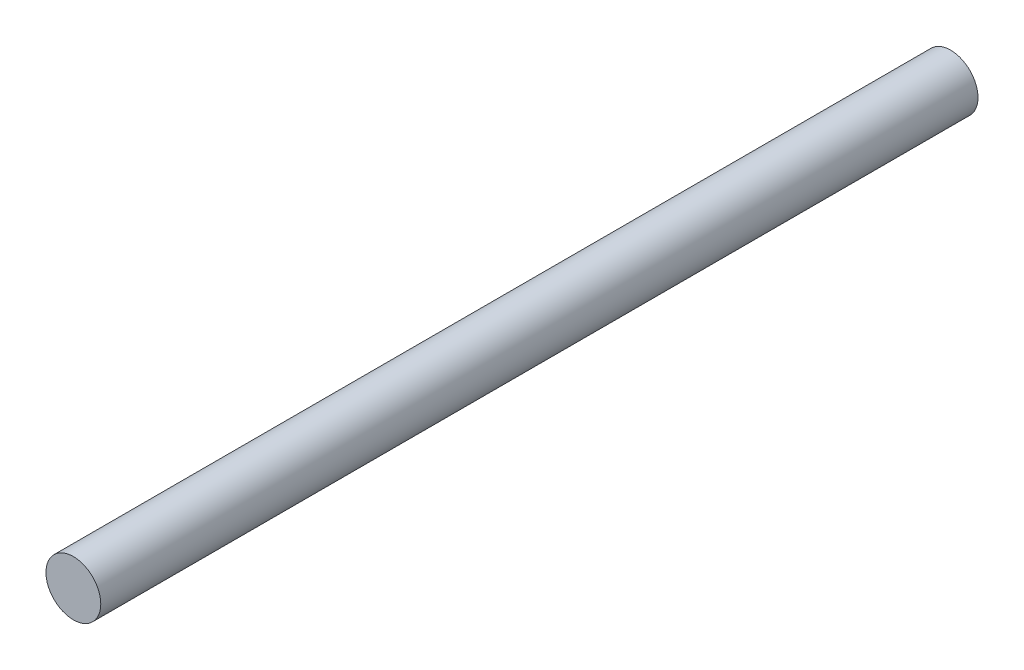
from build123d import *

# Parameters (mm, degrees)
SKETCH1_R           = 6.25
BOSS_EXTRUDE1_DEPTH = 200


with BuildPart() as part:
    # Sketch1 → Boss-Extrude1 (new body)
    with BuildSketch(Plane.XY):
        Circle(SKETCH1_R)
    extrude(amount=BOSS_EXTRUDE1_DEPTH)


solid = part.part
